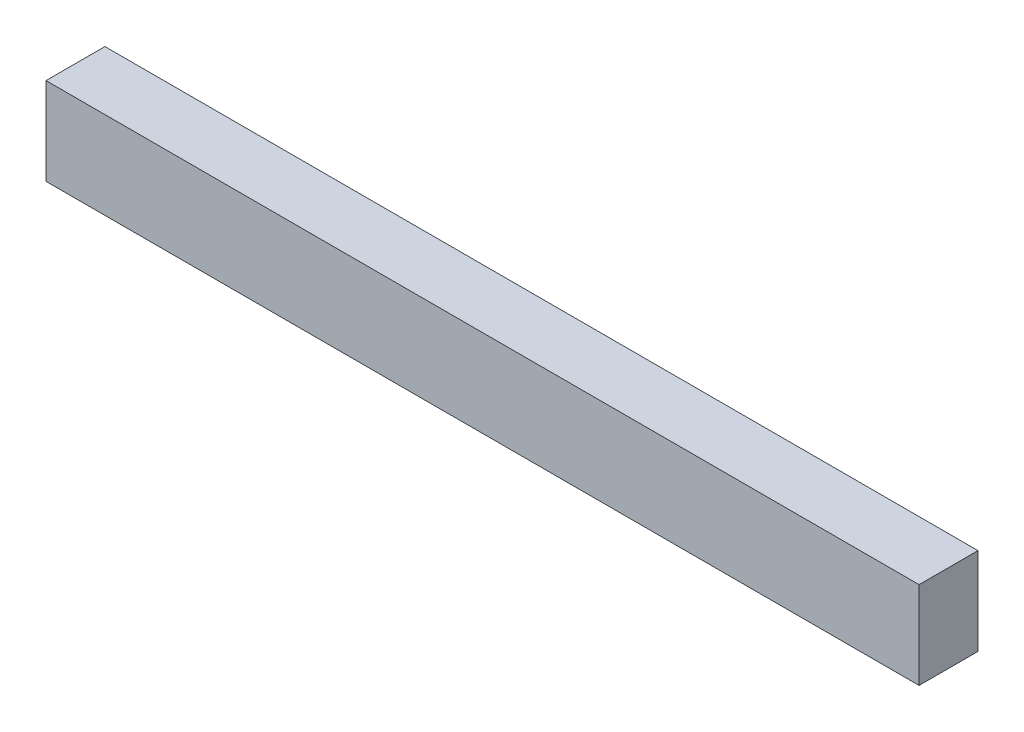
from build123d import *

# Parameters (mm, degrees)
ESQUISSE1_W        = 400
ESQUISSE1_H        = 40
BOSS_EXTRU_1_DEPTH = 27


with BuildPart() as part:
    # Esquisse1 → Boss.-Extru.1 (new body)
    with BuildSketch(Plane.XY):
        with Locations((200, 20)):
            Rectangle(ESQUISSE1_W, ESQUISSE1_H)
    extrude(amount=BOSS_EXTRU_1_DEPTH)


solid = part.part
